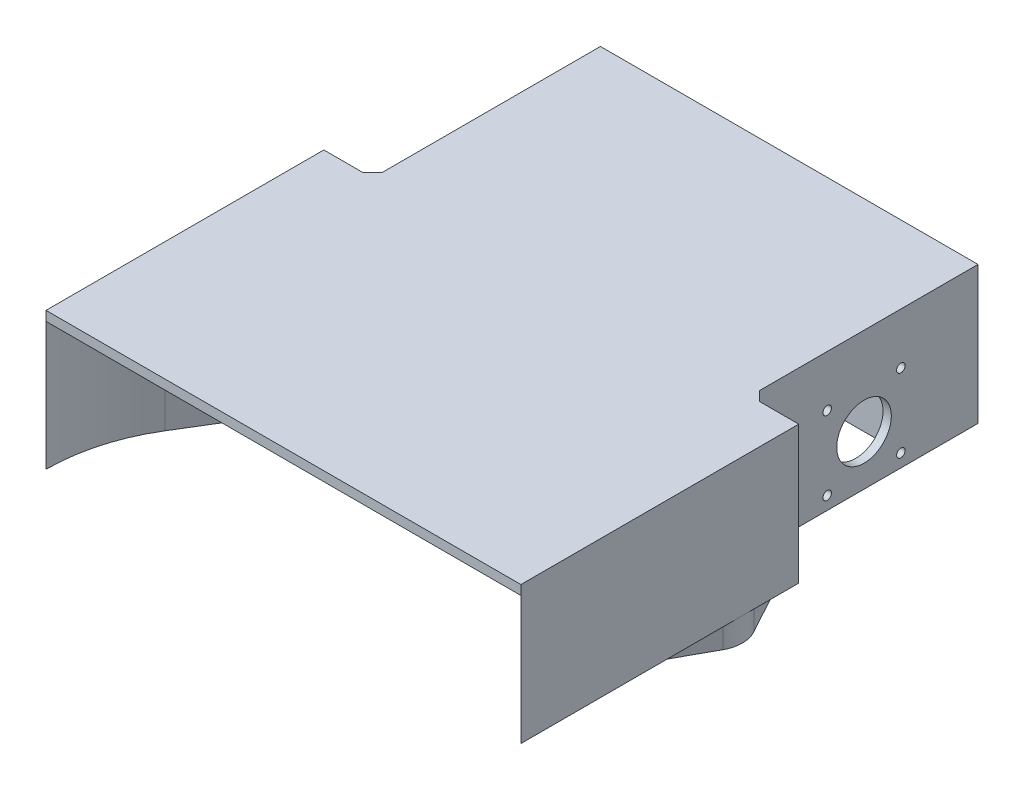
from build123d import *

# Parameters (mm, degrees)
SKETCH_1_W              = 200
SKETCH_1_H              = 213
EXTRUDE_1_DEPTH         = 4
EXTRUDE_2_DEPTH         = 54
CUT_EXTRUDE_2_DEPTH     = 298.880848663
CUT_EXTRUDE_3_DEPTH     = 42
SKETCH_7_R              = 1.8
SKETCH_7_R_2            = 11.5
CUT_EXTRUDE_4_DEPTH     = 282.53330176
MIRROR_START            = 176
MIRROR_1_OUTLINE_R      = 1.8
MIRROR_1_OUTLINE_R_2    = 11.5
MIRROR_1_DEPTH          = 3.5
CUT_EXTRUDE_START       = -21
CUT_EXTRUDE_5_OUTLINE_W = 27
CUT_EXTRUDE_5_OUTLINE_H = 20
CUT_EXTRUDE_5_DEPTH     = 21
CUT_EXTRUDE_START_2     = -6
CUT_EXTRUDE_6_OUTLINE_W = 27
CUT_EXTRUDE_6_OUTLINE_H = 28
CUT_EXTRUDE_6_DEPTH     = 6
CHAMFER_1_SIZE          = 4
CUT_EXTRUDE_START_3     = -54
CUT_EXTRUDE_7_DEPTH     = 54
EXTRUDE_3_DEPTH         = 10


# Read off the part's stored shape, not the designer's step: 镜向1, 切除-拉伸5, 切除-拉伸6
with BuildPart() as part:
    # 草图1 → 凸台-拉伸1 (new body)
    with BuildSketch(Plane(origin=(0, 0, 0), x_dir=(1, 0, 0), z_dir=(0, 1, 0))):
        with Locations((100, 106.5)):
            Rectangle(SKETCH_1_W, SKETCH_1_H)
    extrude(amount=EXTRUDE_1_DEPTH)

    # 草图1<4> → 凸台-拉伸2 (add)
    with BuildSketch(Plane(origin=(0, 0, 0), x_dir=(1, 0, 0), z_dir=(0, 1, 0))):
        with BuildLine():
            Line((0, 213), (0, 0))
            ThreePointArc((0, 0), (21.966991411, 53.033008589), (75, 75))
            Line((75, 75), (75, 213))
            Line((75, 213), (0, 213))
        make_face()
        with BuildLine():
            Line((125, 213), (125, 75))
            ThreePointArc((125, 75), (178.033008589, 53.033008589), (200, 0))
            Line((200, 0), (200, 213))
            Line((200, 213), (125, 213))
        make_face()
    extrude(amount=-EXTRUDE_2_DEPTH)

    # 草图3 → 切除-拉伸2 (cut, through all)
    with BuildSketch(Plane.XZ.offset(54)):
        Polygon((20.5, -186), (20.5, -165), (20.5, -144), (20.5, -117), (0, -117), (0, -213), (20.5, -213), align=None)
        Polygon((179.5, -117), (200, -117), (200, -213), (179.5, -213), (179.5, -165), align=None)
    extrude(amount=-CUT_EXTRUDE_2_DEPTH, mode=Mode.SUBTRACT)

    # 草图5 → 切除-拉伸3 (cut)
    with BuildSketch(Plane.XZ.offset(54)):
        Polygon((176, -165), (176, -144), (125, -144), (125, -186), (176, -186), align=None)
        Polygon((24, -165), (24, -144), (75, -144), (75, -186), (24, -186), align=None)
    extrude(amount=-CUT_EXTRUDE_3_DEPTH, mode=Mode.SUBTRACT)

    # 草图7 → 切除-拉伸4 (cut, through all)
    with BuildSketch(Plane(origin=(24, 0, 0), x_dir=(0, 0, -1), z_dir=(1, 0, 0))):
        with Locations((180.5, -17.5)):
            Circle(SKETCH_7_R)
        with Locations((149.5, -17.5)):
            Circle(SKETCH_7_R)
        with Locations((165, -33)):
            Circle(SKETCH_7_R_2)
        with Locations((180.5, -48.5)):
            Circle(SKETCH_7_R)
        with Locations((149.5, -48.5)):
            Circle(SKETCH_7_R)
    extrude(amount=-CUT_EXTRUDE_4_DEPTH, mode=Mode.SUBTRACT)

    # 镜向1 outline → 镜向1 (cut)
    with BuildSketch(Plane.YZ.offset(MIRROR_START)):
        with Locations((-17.5, -180.5)):
            Circle(MIRROR_1_OUTLINE_R)
        with Locations((-17.5, -149.5)):
            Circle(MIRROR_1_OUTLINE_R)
        with Locations((-33, -165)):
            Circle(MIRROR_1_OUTLINE_R_2)
        with Locations((-48.5, -180.5)):
            Circle(MIRROR_1_OUTLINE_R)
        with Locations((-48.5, -149.5)):
            Circle(MIRROR_1_OUTLINE_R)
    extrude(amount=MIRROR_1_DEPTH, mode=Mode.SUBTRACT)

    # 切除-拉伸5 outline → 切除-拉伸5 (cut)
    with BuildSketch(Plane(origin=(75, 0, 0), x_dir=(0, 0, -1), z_dir=(1, 0, 0)).offset(CUT_EXTRUDE_START)):
        with Locations((199.5, -33)):
            Rectangle(CUT_EXTRUDE_5_OUTLINE_W, CUT_EXTRUDE_5_OUTLINE_H)
    extrude(amount=CUT_EXTRUDE_5_DEPTH, mode=Mode.SUBTRACT)

    # 切除-拉伸6 outline → 切除-拉伸6 (cut)
    with BuildSketch(Plane.ZY.offset(-125).offset(CUT_EXTRUDE_START_2)):
        with Locations((-199.5, -33)):
            Rectangle(CUT_EXTRUDE_6_OUTLINE_W, CUT_EXTRUDE_6_OUTLINE_H)
    extrude(amount=CUT_EXTRUDE_6_DEPTH, mode=Mode.SUBTRACT)

    # 倒角1
    chamfer_1_edges = [part.edges().sort_by_distance(p)[0] for p in [
        (20.5, -25, -117),
        (179.5, -25, -117),
    ]]
    chamfer(chamfer_1_edges, length=CHAMFER_1_SIZE)

    # 草图11 → 切除-拉伸7 (cut)
    with BuildSketch(Plane.XZ.offset(54).offset(CUT_EXTRUDE_START_3)):
        with BuildLine():
            Line((75, -144), (10.975621098, -39.0625))
            ThreePointArc((10.975621098, -39.0625), (38.289562111, -65.401404801), (75, -75))
            Line((75, -75), (75, -144))
        make_face()
        with BuildLine():
            Line((125, -144), (125, -75))
            ThreePointArc((125, -75), (161.710437889, -65.401404801), (189.024378902, -39.0625))
            Line((189.024378902, -39.0625), (125, -144))
        make_face()
    extrude(amount=CUT_EXTRUDE_7_DEPTH, mode=Mode.SUBTRACT)

    # 草图12 → 凸台-拉伸3 (add)
    with BuildSketch(Plane(origin=(0, -54, 0), x_dir=(-1, 0, 0), z_dir=(0, -1, 0))):
        with BuildLine():
            Line((-9.993972793, 71.605361452), (-1.667158175, 86.766701767))
            ThreePointArc((-1.667158175, 86.766701767), (0, 93.265459675), (-1.667158175, 99.764217583))
            Line((-1.667158175, 99.764217583), (-9.993972793, 114.925557899))
            ThreePointArc((-9.993972793, 114.925557899), (-13.5, 117), (-17.006027207, 114.925557899))
            Line((-17.006027207, 114.925557899), (-25.332841825, 99.764217583))
            ThreePointArc((-25.332841825, 99.764217583), (-27, 93.265459675), (-25.332841825, 86.766701767))
            Line((-25.332841825, 86.766701767), (-17.006027207, 71.605361452))
            ThreePointArc((-17.006027207, 71.605361452), (-13.5, 69.53091935), (-9.993972793, 71.605361452))
        make_face()
        with BuildLine():
            Line((-190.006027207, 114.925557899), (-198.332841825, 99.764217583))
            ThreePointArc((-198.332841825, 99.764217583), (-200, 93.265459675), (-198.332841825, 86.766701767))
            Line((-198.332841825, 86.766701767), (-190.006027207, 71.605361452))
            ThreePointArc((-190.006027207, 71.605361452), (-186.5, 69.53091935), (-182.993972793, 71.605361452))
            Line((-182.993972793, 71.605361452), (-174.667158175, 86.766701767))
            ThreePointArc((-174.667158175, 86.766701767), (-173, 93.265459675), (-174.667158175, 99.764217583))
            Line((-174.667158175, 99.764217583), (-182.993972793, 114.925557899))
            ThreePointArc((-182.993972793, 114.925557899), (-186.5, 117), (-190.006027207, 114.925557899))
        make_face()
    extrude(amount=EXTRUDE_3_DEPTH)


solid = part.part
